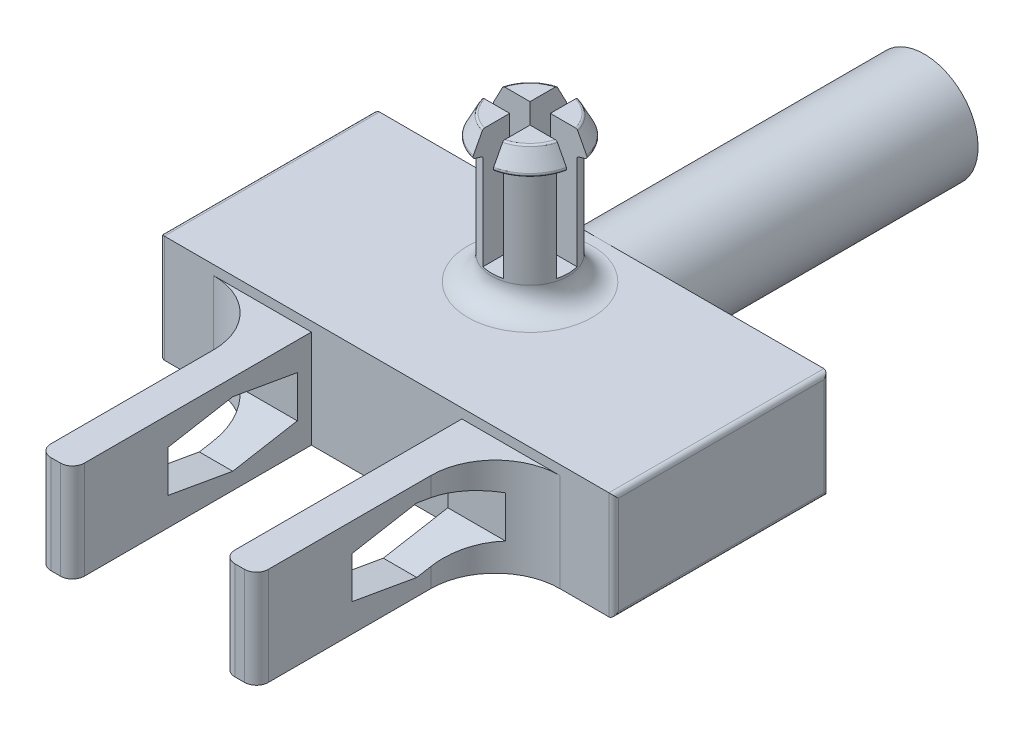
from build123d import *

# Parameters (mm, degrees)
DODANIE_WYCI_GNI_CIE1_DEPTH     = 4.5
DODANIE_WYCI_GNI_CIE2_DEPTH     = 4.1
SZKIC2_R                        = 2.25
DODANIE_WYCI_GNI_CIE3_DEPTH     = 13.5
WYTNIJ_WYCI_GNI_CIE2_DEPTH      = 23.456012558
WYTNIJ_WYCI_GNI_CIE2_DEPTH_BACK = 23.456012558
ZAOKR_GLENIE1_R                 = 0.5
ZAOKR_GLENIE2_R                 = 0.2
SZKIC4_R                        = 1.6
DODANIE_WYCI_GNI_CIE4_DEPTH     = 5.1
SZKIC5_R                        = 1.6
DODANIE_WYCI_GNI_CIE5_DEPTH     = 1
ZAOKR_GLENIE4_R                 = 1
ZAOKR_GLENIE5_R                 = 0.1
WYTNIJ_WYCI_GNI_CIE3_DEPTH      = 5


with BuildPart() as part:
    # Szkic1 → Dodanie-wyciągnięcie1 (new body)
    with BuildSketch(Plane(origin=(0, 0, 0), x_dir=(1, 0, 0), z_dir=(0, 1, 0))):
        Polygon((3.15, -4.5), (4.55, -4.5), (7.25, -4.5), (9.5, -4.5), (9.5, 4.5), (2.579268293, 4.5), (-2.579268293, 4.5), (-9.5, 4.5), (-9.5, -4.5), (-7.25, -4.5), (-4.55, -4.5), (-3.15, -4.5), align=None)
    extrude(amount=DODANIE_WYCI_GNI_CIE1_DEPTH)

    # Szkic1<7> → Dodanie-wyciągnięcie2 (add)
    with BuildSketch(Plane(origin=(0, 0, 0), x_dir=(1, 0, 0), z_dir=(0, 1, 0))):
        with BuildLine():
            Line((4.55, -14.5), (4.55, -7.2))
            ThreePointArc((4.55, -7.2), (5.340811691, -5.290811691), (7.25, -4.5))
            Line((7.25, -4.5), (3.15, -4.5))
            Line((3.15, -4.5), (3.15, -14.5))
            Line((3.15, -14.5), (4.55, -14.5))
        make_face()
        with BuildLine():
            Line((-3.15, -14.5), (-3.15, -4.5))
            Line((-3.15, -4.5), (-7.25, -4.5))
            ThreePointArc((-7.25, -4.5), (-5.340811691, -5.290811691), (-4.55, -7.2))
            Line((-4.55, -7.2), (-4.55, -14.5))
            Line((-4.55, -14.5), (-3.15, -14.5))
        make_face()
    extrude(amount=DODANIE_WYCI_GNI_CIE2_DEPTH)

    # Szkic2 → Dodanie-wyciągnięcie3 (add)
    with BuildSketch(Plane(origin=(0, 0, -4.5), x_dir=(-1, 0, 0), z_dir=(0, 0, -1))):
        with Locations((0, 2.25)):
            Circle(SZKIC2_R)
    extrude(amount=DODANIE_WYCI_GNI_CIE3_DEPTH)

    # Szkic3 → Wytnij-wyciągnięcie2 (cut, two sides: drawn at the far end of the back side and taken through both)
    with BuildSketch(Plane(origin=(-3.15, 0, 0), x_dir=(0, 0, -1), z_dir=(1, 0, 0)).offset(-WYTNIJ_WYCI_GNI_CIE2_DEPTH_BACK)):
        Polygon((-7.790001582, 3.4), (-10.490001582, 2.923917152), (-10.490001582, 1.176082848), (-7.790001582, 0.7), (-5.090001582, 1.176082848), (-5.090001582, 2.923917152), align=None)
    extrude(amount=WYTNIJ_WYCI_GNI_CIE2_DEPTH + WYTNIJ_WYCI_GNI_CIE2_DEPTH_BACK, mode=Mode.SUBTRACT)

    # Zaokrąglenie1
    zaokr_glenie1_edges = [part.edges().sort_by_distance(p)[0] for p in [
        (3.15, 2.05, 14.5),
        (4.55, 2.05, 14.5),
        (-4.55, 2.05, 14.5),
        (-3.15, 2.05, 14.5),
    ]]
    fillet(zaokr_glenie1_edges, radius=ZAOKR_GLENIE1_R)

    # Zaokrąglenie2
    zaokr_glenie2_edges = [part.edges().sort_by_distance(p)[0] for p in [
        (-9.5, 2.25, -4.5),
        (-9.5, 4.5, 0),
        (9.5, 0, 0),
        (-9.5, 2.25, 4.5),
        (9.5, 2.25, 4.5),
        (9.5, 2.25, -4.5),
        (9.5, 4.5, 0),
        (-9.5, 0, 0),
    ]]
    fillet(zaokr_glenie2_edges, radius=ZAOKR_GLENIE2_R)

    # Szkic4 → Dodanie-wyciągnięcie4 (add)
    with BuildSketch(Plane(origin=(0, 4.5, 0), x_dir=(1, 0, 0), z_dir=(0, 1, 0))):
        with Locations((0, 1.5)):
            Circle(SZKIC4_R)
    extrude(amount=DODANIE_WYCI_GNI_CIE4_DEPTH)

    # Szkic5 → Dodanie-wyciągnięcie5 (add)
    with BuildSketch(Plane(origin=(0, 9.6, 0), x_dir=(1, 0, 0), z_dir=(0, 1, 0))):
        with Locations((0, 1.5)):
            Circle(SZKIC5_R)
    extrude(amount=DODANIE_WYCI_GNI_CIE5_DEPTH)

    # Zaokrąglenie4
    zaokr_glenie4_edges = [part.edges().sort_by_distance(p)[0] for p in [
        (-1.6, 4.5, -1.5),
    ]]
    fillet(zaokr_glenie4_edges, radius=ZAOKR_GLENIE4_R)

    # Szkic7 → Obrót1 (revolve)
    with BuildSketch(Plane(origin=(0, 0, 0), x_dir=(0, 0, -1), z_dir=(1, 0, 0))):
        Polygon((3.1, 10.6), (3.1, 9.6), (3.55, 9.720577137), align=None)
    revolve(axis=Axis((0, 10.6, -1.5), (0, -1, 0)))

    # Zaokrąglenie5
    zaokr_glenie5_edges = [part.edges().sort_by_distance(p)[0] for p in [
        (-1.13137085, 9.6, -0.36862915),
        (0, 9.720577137, 0.55),
        (0, 10.6, 0.1),
    ]]
    fillet(zaokr_glenie5_edges, radius=ZAOKR_GLENIE5_R)

    # Szkic6 → Wytnij-wyciągnięcie3 (cut)
    with BuildSketch(Plane(origin=(0, 10.6, 0), x_dir=(1, 0, 0), z_dir=(0, 1, 0))):
        with BuildLine():
            Line((0.425, 4.714465969), (0.425, 1.925))
            Line((0.425, 1.925), (3.214465969, 1.925))
            ThreePointArc((3.214465969, 1.925), (3.242439894, 1.5), (3.214465969, 1.075))
            Line((3.214465969, 1.075), (0.425, 1.075))
            Line((0.425, 1.075), (0.425, -1.714465969))
            ThreePointArc((0.425, -1.714465969), (0, -1.742439894), (-0.425, -1.714465969))
            Line((-0.425, -1.714465969), (-0.425, 1.075))
            Line((-0.425, 1.075), (-3.214465969, 1.075))
            ThreePointArc((-3.214465969, 1.075), (-3.242439894, 1.5), (-3.214465969, 1.925))
            Line((-3.214465969, 1.925), (-0.425, 1.925))
            Line((-0.425, 1.925), (-0.425, 4.714465969))
            ThreePointArc((-0.425, 4.714465969), (0, 4.742439894), (0.425, 4.714465969))
        make_face()
    extrude(amount=-WYTNIJ_WYCI_GNI_CIE3_DEPTH, mode=Mode.SUBTRACT)


solid = part.part
